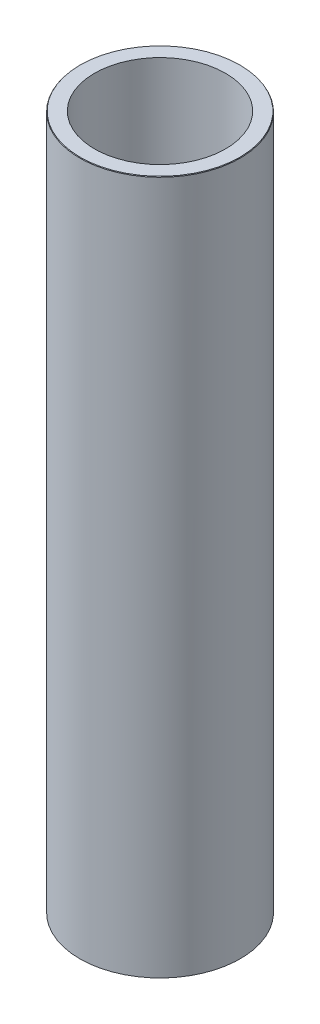
from build123d import *
from OCP.BRepFilletAPI import BRepFilletAPI_MakeChamfer

# Parameters (mm, degrees)
SKETCH1_R           = 50
BOSS_EXTRUDE1_DEPTH = 432.641620748
SKETCH2_R           = 40.845883315
CUT_EXTRUDE1_DEPTH  = 439.381993248
CHAMFER1_SIZE       = 0.3863928
CHAMFER1_SIZE2      = 0.245557044


with BuildPart() as part:
    # Sketch1 → Boss-Extrude1 (new body)
    with BuildSketch(Plane(origin=(0, 0, 0), x_dir=(1, 0, 0), z_dir=(0, 1, 0))):
        Circle(SKETCH1_R)
    extrude(amount=BOSS_EXTRUDE1_DEPTH)

    # Sketch2 → Cut-Extrude1 (cut, through all)
    with BuildSketch(Plane(origin=(0, 0, 0), x_dir=(1, 0, 0), z_dir=(0, 1, 0))):
        Circle(SKETCH2_R)
    extrude(amount=CUT_EXTRUDE1_DEPTH, mode=Mode.SUBTRACT)

    # Chamfer1: one chamfer whose edges measure the first distance from different faces: ONE call of the kernel's chamfer builder (chamfer() names one face for all edges)
    chamfer1_edges_1 = [part.edges().sort_by_distance(p)[0] for p in [
        (-50, 432.641620748, 0),
    ]]
    chamfer1_side_1 = [part.faces().sort_by_distance(p)[0] for p in [
        (-50, 216.320810374, 0),
    ]]
    chamfer1_edges_2 = [part.edges().sort_by_distance(p)[0] for p in [
        (-50, 0, 0),
    ]]
    chamfer1_side_2 = [part.faces().sort_by_distance(p)[0] for p in [
        (-48.585786438, 0, 0),
    ]]
    chamfer1 = BRepFilletAPI_MakeChamfer(part.part.solid().wrapped)
    for e in chamfer1_edges_1:
        chamfer1.Add(CHAMFER1_SIZE, CHAMFER1_SIZE2, e.wrapped, chamfer1_side_1[0].wrapped)  # the first distance lies on this face
    for e in chamfer1_edges_2:
        chamfer1.Add(CHAMFER1_SIZE, CHAMFER1_SIZE2, e.wrapped, chamfer1_side_2[0].wrapped)  # the first distance lies on this face
    add(Compound.cast(chamfer1.Shape()), mode=Mode.REPLACE)


solid = part.part
